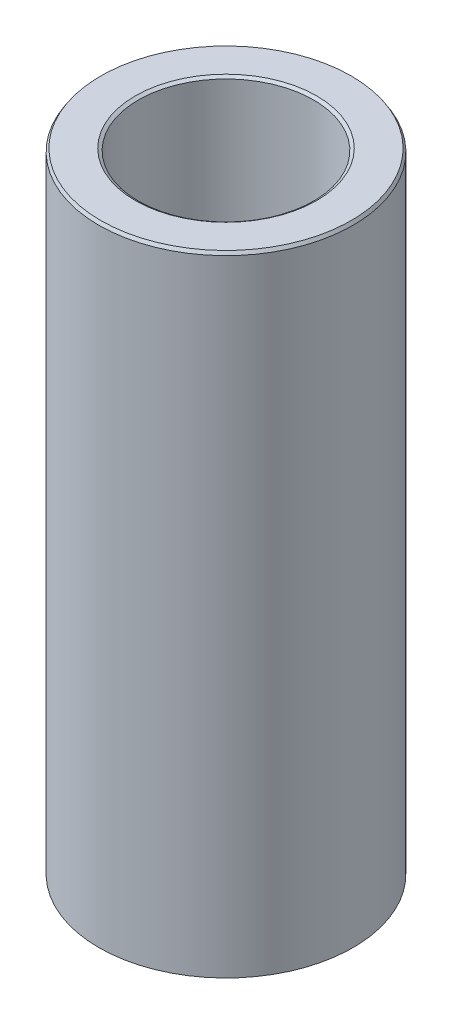
from build123d import *
from OCP.BRepFilletAPI import BRepFilletAPI_MakeChamfer

# Parameters (mm, degrees)
SKETCH1_R           = 55
BOSS_EXTRUDE1_DEPTH = 272.677087325
SKETCH2_R           = 37.885455612
CUT_EXTRUDE1_DEPTH  = 284.553864286
CHAMFER1_SIZE       = 1.335110825
CHAMFER1_SIZE2      = 0.850916116


with BuildPart() as part:
    # Sketch1 → Boss-Extrude1 (new body)
    with BuildSketch(Plane(origin=(0, 0, 0), x_dir=(1, 0, 0), z_dir=(0, 1, 0))):
        Circle(SKETCH1_R)
    extrude(amount=BOSS_EXTRUDE1_DEPTH)

    # Sketch2 → Cut-Extrude1 (cut, through all)
    with BuildSketch(Plane(origin=(0, 0, 0), x_dir=(1, 0, 0), z_dir=(0, 1, 0))):
        Circle(SKETCH2_R)
    extrude(amount=CUT_EXTRUDE1_DEPTH, mode=Mode.SUBTRACT)

    # Chamfer1: one chamfer whose edges measure the first distance from different faces: ONE call of the kernel's chamfer builder (chamfer() names one face for all edges)
    chamfer1_edges_1 = [part.edges().sort_by_distance(p)[0] for p in [
        (-37.885455612, 272.677087325, 0),
    ]]
    chamfer1_side_1 = [part.faces().sort_by_distance(p)[0] for p in [
        (-53.444365081, 272.677087325, 0),
    ]]
    chamfer1_edges_2 = [part.edges().sort_by_distance(p)[0] for p in [
        (-37.885455612, 0, 0),
    ]]
    chamfer1_side_2 = [part.faces().sort_by_distance(p)[0] for p in [
        (-37.885455612, 136.338543662, 0),
    ]]
    chamfer1_edges_3 = [part.edges().sort_by_distance(p)[0] for p in [
        (-55, 0, 0),
    ]]
    chamfer1_side_3 = [part.faces().sort_by_distance(p)[0] for p in [
        (-53.444365081, 0, 0),
    ]]
    chamfer1_edges_4 = [part.edges().sort_by_distance(p)[0] for p in [
        (-55, 272.677087325, 0),
    ]]
    chamfer1_side_4 = [part.faces().sort_by_distance(p)[0] for p in [
        (-55, 136.338543662, 0),
    ]]
    chamfer1 = BRepFilletAPI_MakeChamfer(part.part.solid().wrapped)
    for e in chamfer1_edges_1:
        chamfer1.Add(CHAMFER1_SIZE, CHAMFER1_SIZE2, e.wrapped, chamfer1_side_1[0].wrapped)  # the first distance lies on this face
    for e in chamfer1_edges_2:
        chamfer1.Add(CHAMFER1_SIZE, CHAMFER1_SIZE2, e.wrapped, chamfer1_side_2[0].wrapped)  # the first distance lies on this face
    for e in chamfer1_edges_3:
        chamfer1.Add(CHAMFER1_SIZE, CHAMFER1_SIZE2, e.wrapped, chamfer1_side_3[0].wrapped)  # the first distance lies on this face
    for e in chamfer1_edges_4:
        chamfer1.Add(CHAMFER1_SIZE, CHAMFER1_SIZE2, e.wrapped, chamfer1_side_4[0].wrapped)  # the first distance lies on this face
    add(Compound.cast(chamfer1.Shape()), mode=Mode.REPLACE)


solid = part.part
